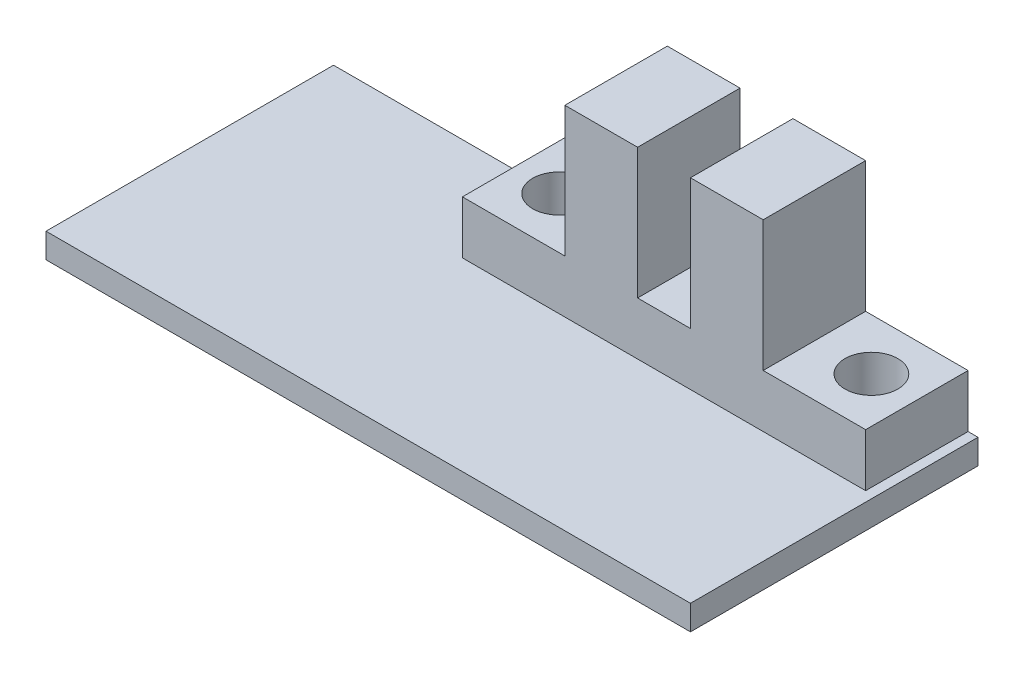
from build123d import *

# Parameters (mm, degrees)
SKETCH1_W           = 39
SKETCH1_H           = 17.4
BOSS_EXTRUDE1_DEPTH = 1.5
SKETCH2_W           = 24.4
SKETCH2_H           = 6.2
BOSS_EXTRUDE2_DEPTH = 3.2
SKETCH3_W           = 4.4
SKETCH3_H           = 6.2
BOSS_EXTRUDE3_DEPTH = 7.9
SKETCH4_R           = 1.6
CUT_EXTRUDE1_DEPTH  = 23.767301114


with BuildPart() as part:
    # Sketch1 → Boss-Extrude1 (new body)
    with BuildSketch(Plane(origin=(0, 0, 0), x_dir=(1, 0, 0), z_dir=(0, 1, 0))):
        Rectangle(SKETCH1_W, SKETCH1_H)
    extrude(amount=BOSS_EXTRUDE1_DEPTH)

    # Sketch2 → Boss-Extrude2 (add)
    with BuildSketch(Plane(origin=(0, 1.5, 0), x_dir=(1, 0, 0), z_dir=(0, 1, 0))):
        with Locations((6.7, 5.6)):
            Rectangle(SKETCH2_W, SKETCH2_H)
    extrude(amount=BOSS_EXTRUDE2_DEPTH)

    # Sketch3 → Boss-Extrude3 (add)
    with BuildSketch(Plane(origin=(0, 4.7, 0), x_dir=(1, 0, 0), z_dir=(0, 1, 0))):
        with Locations((2.9, 5.6)):
            Rectangle(SKETCH3_W, SKETCH3_H)
        with Locations((10.5, 5.6)):
            Rectangle(SKETCH3_W, SKETCH3_H)
    extrude(amount=BOSS_EXTRUDE3_DEPTH)

    # Sketch4 → Cut-Extrude1 (cut, through all)
    with BuildSketch(Plane(origin=(0, 4.7, 0), x_dir=(1, 0, 0), z_dir=(0, 1, 0))):
        with Locations((-2.75, 5.6)):
            Circle(SKETCH4_R)
        with Locations((16.15, 5.6)):
            Circle(SKETCH4_R)
    extrude(amount=-CUT_EXTRUDE1_DEPTH, mode=Mode.SUBTRACT)


solid = part.part
